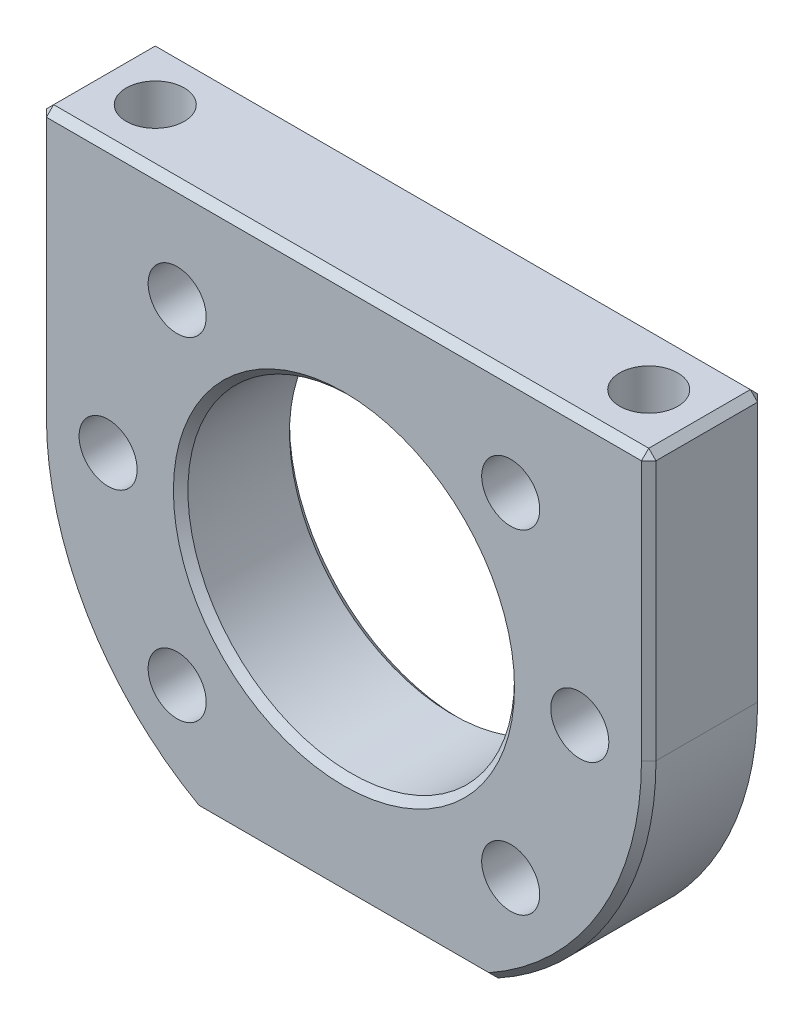
from build123d import *

# Parameters (mm, degrees)
BOSS_EXTRUDE1_DEPTH = 4
SKETCH2_R           = 11.25
CUT_EXTRUDE1_DEPTH  = 30.044104393
SKETCH3_R           = 2
CUT_EXTRUDE2_DEPTH  = 8
SKETCH6_R           = 2
CUT_EXTRUDE3_DEPTH  = 8
CHAMFER1_SIZE       = 0.5


with BuildPart() as part:
    # Sketch1 → Boss-Extrude1 (new, symmetric)
    with BuildSketch(Plane.XY):
        with BuildLine():
            Line((21, 0), (21, 18.4))
            Line((21, 18.4), (-21, 18.4))
            Line((-21, 18.4), (-21, 0))
            ThreePointArc((-21, 0), (-18.076871405, -10.687690125), (-10.121264743, -18.4))
            Line((-10.121264743, -18.4), (10.121264743, -18.4))
            ThreePointArc((10.121264743, -18.4), (18.076871405, -10.687690125), (21, 0))
        make_face()
    extrude(amount=BOSS_EXTRUDE1_DEPTH, both=True)

    # Sketch2 → Cut-Extrude1 (cut, through all)
    with BuildSketch(Plane.XY.offset(4)):
        Circle(SKETCH2_R)
    extrude(amount=-CUT_EXTRUDE1_DEPTH, mode=Mode.SUBTRACT)

    # Sketch3 → Cut-Extrude2 (cut)
    with BuildSketch(Plane.XY.offset(4)):
        with Locations((-16.25, 0)):
            Circle(SKETCH3_R)
        with Locations((16.25, 0)):
            Circle(SKETCH3_R)
        with Locations((-11.490485194, 11.490485194)):
            Circle(SKETCH3_R)
        with Locations((11.490485194, 11.490485194)):
            Circle(SKETCH3_R)
        with Locations((11.490485194, -11.490485194)):
            Circle(SKETCH3_R)
        with Locations((-11.490485194, -11.490485194)):
            Circle(SKETCH3_R)
    extrude(amount=-CUT_EXTRUDE2_DEPTH, mode=Mode.SUBTRACT)

    # Sketch6 → Cut-Extrude3 (cut)
    with BuildSketch(Plane(origin=(-3.375, 18.4, 0), x_dir=(0, 0, -1), z_dir=(0, -1, 0))):
        with Locations((0, -13.625)):
            Circle(SKETCH6_R)
        with Locations((0, 20.375)):
            Circle(SKETCH6_R)
    extrude(amount=CUT_EXTRUDE3_DEPTH, mode=Mode.SUBTRACT)

    # Chamfer1
    chamfer1_edges = [part.edges().sort_by_distance(p)[0] for p in [
        (-11.25, 0, -4),
        (21, 18.4, 0),
        (-21, 9.2, 4),
        (-18.076871405, -10.687690125, 4),
        (0, -18.4, 4),
        (18.076871405, -10.687690125, 4),
        (21, 9.2, 4),
        (0, 18.4, 4),
        (-21, 18.4, 0),
        (-21, 9.2, -4),
        (-18.076871405, -10.687690125, -4),
        (0, -18.4, -4),
        (18.076871405, -10.687690125, -4),
        (21, 9.2, -4),
        (0, 18.4, -4),
        (-11.25, 0, 4),
    ]]
    chamfer(chamfer1_edges, length=CHAMFER1_SIZE)


solid = part.part
